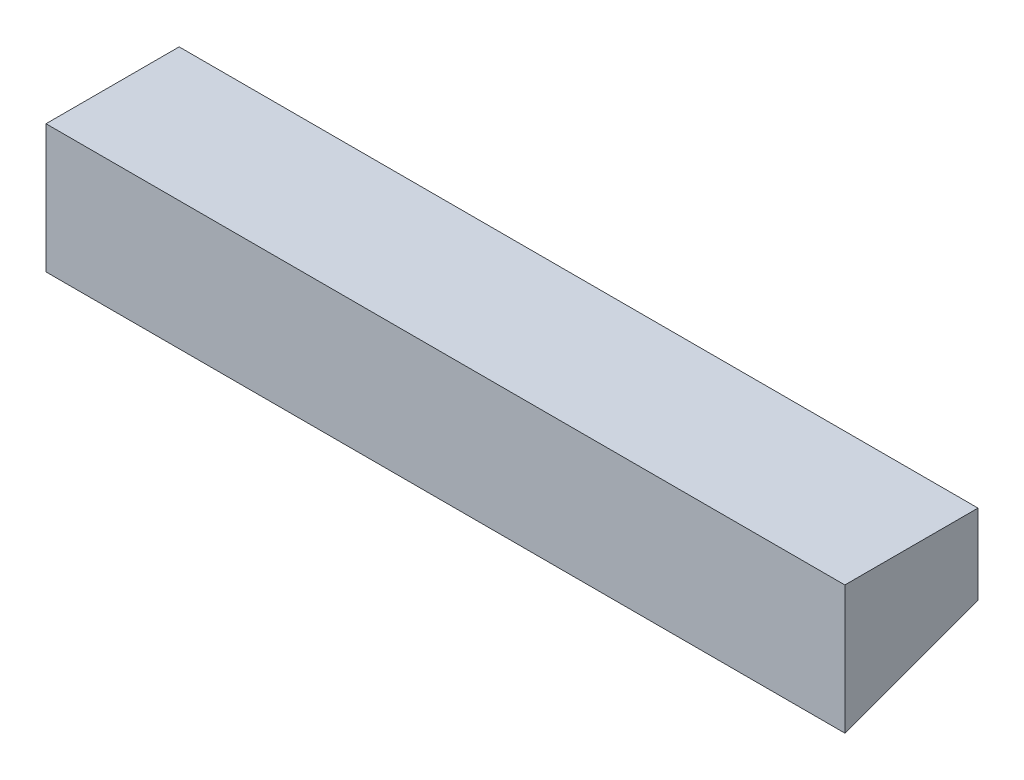
from build123d import *

# Parameters (mm, degrees)
SKETCH_1_W       = 30
SKETCH_1_H       = 5
EXTRUDE_1_DEPTH  = 2.5
CHAMFER_1_SIZE   = 5.494954839
CHAMFER_1_SIZE_2 = 2


with BuildPart() as part:
    # Эскиз1 → Бобышка-Вытянуть1 (new, symmetric)
    with BuildSketch(Plane.XY):
        Rectangle(SKETCH_1_W, SKETCH_1_H)
    extrude(amount=EXTRUDE_1_DEPTH, both=True)

    # Фаска1
    # the kernel refuses this chamfer: 5.494954839, 2 mm, written as the material it takes off along each edge
    with BuildSketch(Plane(origin=(29.254982899, -2.5, -2.5), x_dir=(0, -0.013184058198645794, 0.9999130865277316), z_dir=(-1, 0, 0))) as chamfer_1_piece_1:
        Polygon((CHAMFER_1_SIZE * 0.999913086511, CHAMFER_1_SIZE * 0.0131840581984), (-CHAMFER_1_SIZE_2 * 0.0131840581986, CHAMFER_1_SIZE_2 * 0.999913086528), (0, 0), align=None)
    extrude(amount=58.509965797, mode=Mode.SUBTRACT)


solid = part.part
